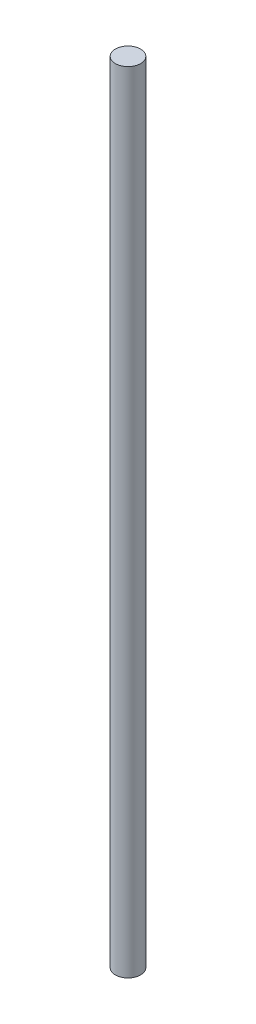
from build123d import *

# Parameters (mm, degrees)
SKETCH1_R           = 3.175
BOSS_EXTRUDE1_DEPTH = 198.575000106


with BuildPart() as part:
    # Sketch1 → Boss-Extrude1 (new body)
    with BuildSketch(Plane(origin=(0, 0, 0), x_dir=(1, 0, 0), z_dir=(0, 1, 0))):
        Circle(SKETCH1_R)
    extrude(amount=BOSS_EXTRUDE1_DEPTH)


solid = part.part
